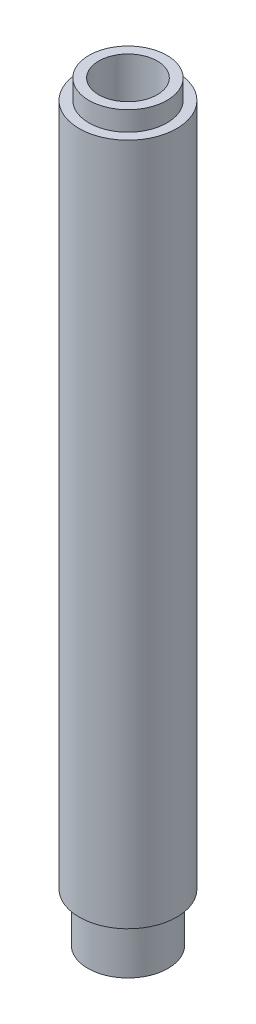
from build123d import *

# Parameters (mm, degrees)
SKETCH1_R           = 12.7
BOSS_EXTRUDE1_DEPTH = 177.8
SKETCH4_R           = 10.16
BOSS_EXTRUDE2_DEPTH = 5.08
SKETCH5_R           = 7.62
CUT_EXTRUDE1_DEPTH  = 184.759828036
SKETCH6_R           = 10.4394
SKETCH6_R_2         = 7.62
BOSS_EXTRUDE3_DEPTH = 12.7


with BuildPart() as part:
    # Sketch1 → Boss-Extrude1 (new body)
    with BuildSketch(Plane(origin=(0, 0, 0), x_dir=(1, 0, 0), z_dir=(0, 1, 0))):
        Circle(SKETCH1_R)
    extrude(amount=BOSS_EXTRUDE1_DEPTH)

    # Sketch4 → Boss-Extrude2 (add)
    with BuildSketch(Plane(origin=(0, 177.8, 0), x_dir=(1, 0, 0), z_dir=(0, 1, 0))):
        Circle(SKETCH4_R)
    extrude(amount=BOSS_EXTRUDE2_DEPTH)

    # Sketch5 → Cut-Extrude1 (cut, through all)
    with BuildSketch(Plane(origin=(0, 182.88, 0), x_dir=(1, 0, 0), z_dir=(0, 1, 0))):
        Circle(SKETCH5_R)
    extrude(amount=-CUT_EXTRUDE1_DEPTH, mode=Mode.SUBTRACT)

    # Sketch6 → Boss-Extrude3 (add)
    with BuildSketch(Plane.XZ):
        Circle(SKETCH6_R)
        Circle(SKETCH6_R_2, mode=Mode.SUBTRACT)
    extrude(amount=BOSS_EXTRUDE3_DEPTH)


solid = part.part
